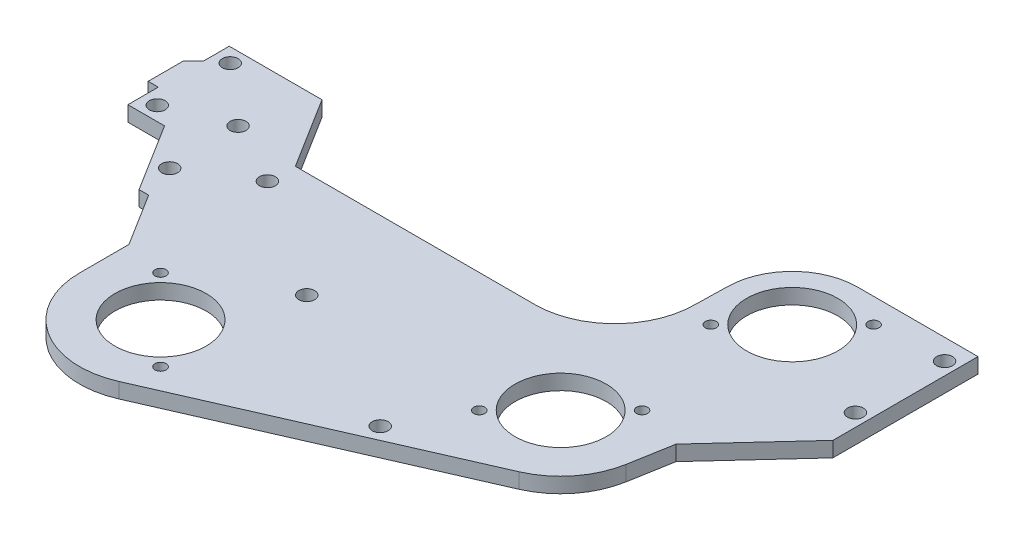
from build123d import *

# Parameters (mm, degrees)
SKETCH1_R                 = 14.29004
BOSS_EXTRUDE1_DEPTH       = 4.7625
F_10_CLEARANCE_HOLE1_D    = 4.9784
F_10_CLEARANCE_HOLE2_D    = 4.9784
TAP_DRILL_FOR_8_32_TAP1_D = 3.4544
F_10_CLEARANCE_HOLE3_D    = 4.9784


with BuildPart() as part:
    # Sketch1 → Boss-Extrude1 (new body)
    with BuildSketch(Plane(origin=(0, 0, 0), x_dir=(1, 0, 0), z_dir=(0, 1, 0))):
        with BuildLine():
            Line((-62.038222018, -79.883349745), (25.167081601, -41.695780276))
            ThreePointArc((25.167081601, -41.695780276), (34.91524479, -34.148496119), (39.940188099, -22.890693115))
            Line((39.940188099, -22.890693115), (42.275148896, -9.586739751))
            Line((42.275148896, -9.586739751), (65.831008632, 16.012754812))
            Line((65.831008632, 16.012754812), (65.831008632, 61.493591694))
            Line((65.831008632, 61.493591694), (28.046575186, 61.493591694))
            ThreePointArc((28.046575186, 61.493591694), (13.665119108, 55.581463016), (7.599980341, 41.263864189))
            Line((7.599980341, 41.263864189), (7.377499016, 31.276274442))
            ThreePointArc((7.377499016, 31.276274442), (0.022382465, 13.519452313), (-17.734439664, 6.164335762))
            Line((-17.734439664, 6.164335762), (-92.776174625, 6.164335762))
            Line((-92.776174625, 6.164335762), (-106.671272051, 28.401139958))
            Line((-106.671272051, 28.401139958), (-135.754553791, 28.401139958))
            Line((-135.754553791, 28.401139958), (-135.754553791, 20.45773786))
            Line((-135.754553791, 20.45773786), (-138.929553791, 17.28273786))
            Line((-138.929553791, 17.28273786), (-138.929553791, 6.164335762))
            Line((-138.929553791, 6.164335762), (-135.754553791, 6.164335762))
            Line((-135.754553791, 6.164335762), (-135.754553791, -3.360664238))
            Line((-135.754553791, -3.360664238), (-124.263208355, -3.360664238))
            Line((-124.263208355, -3.360664238), (-110.958501432, -24.652646126))
            Line((-110.958501432, -24.652646126), (-107.963388287, -24.652646126))
            Line((-107.963388287, -24.652646126), (-97.659911134, -41.141656383))
            Line((-97.659911134, -41.141656383), (-97.659911134, -56.628468385))
            ThreePointArc((-97.659911134, -56.628468385), (-86.144175153, -77.898718987), (-62.038222018, -79.883349745))
        make_face()
        with Locations((28.046575186, 41.045834415)):
            Circle(SKETCH1_R, mode=Mode.SUBTRACT)
        with Locations((15.031008632, -18.508482198)):
            Circle(SKETCH1_R, mode=Mode.SUBTRACT)
        with Locations((-72.258332946, -56.628468385)):
            Circle(SKETCH1_R, mode=Mode.SUBTRACT)
    extrude(amount=BOSS_EXTRUDE1_DEPTH)

    # #10 Clearance Hole1 (through all)
    with Locations(Plane(origin=(0, 4.7625, 0), x_dir=(1, 0, 0), z_dir=(0, 1, 0))):
        with Locations((61.830508632, 55.015834415), (61.830508632, 27.075834415), (-130.992053791, 23.944335762), (-130.992053791, 1.084335762)):
            Hole(F_10_CLEARANCE_HOLE1_D / 2)

    # #10 Clearance Hole2 (through all)
    with Locations(Plane(origin=(0, 4.7625, 0), x_dir=(1, 0, 0), z_dir=(0, 1, 0))):
        with Locations((-111.967153366, -14.051247514), (-93.119284429, -2.273791866), (-112.732400526, 8.143579493)):
            Hole(F_10_CLEARANCE_HOLE2_D / 2)

    # Tap Drill for #8-32 Tap1 (through all)
    with Locations(Plane(origin=(0, 4.7625, 0), x_dir=(1, 0, 0), z_dir=(0, 1, 0))):
        with Locations((-85.010296638, -43.876504694), (-59.506369254, -69.380432077), (2.27904494, -31.26044589), (27.782972324, -5.756518506), (15.294611495, 28.293870723), (40.798538878, 53.797798107)):
            Hole(TAP_DRILL_FOR_8_32_TAP1_D / 2)

    # #10 Clearance Hole3 (through all)
    with Locations(Plane(origin=(0, 4.7625, 0), x_dir=(1, 0, 0), z_dir=(0, 1, 0))):
        with Locations((-56.041369259, -27.019222928), (-8.951277081, -51.090630662)):
            Hole(F_10_CLEARANCE_HOLE3_D / 2)


solid = part.part
